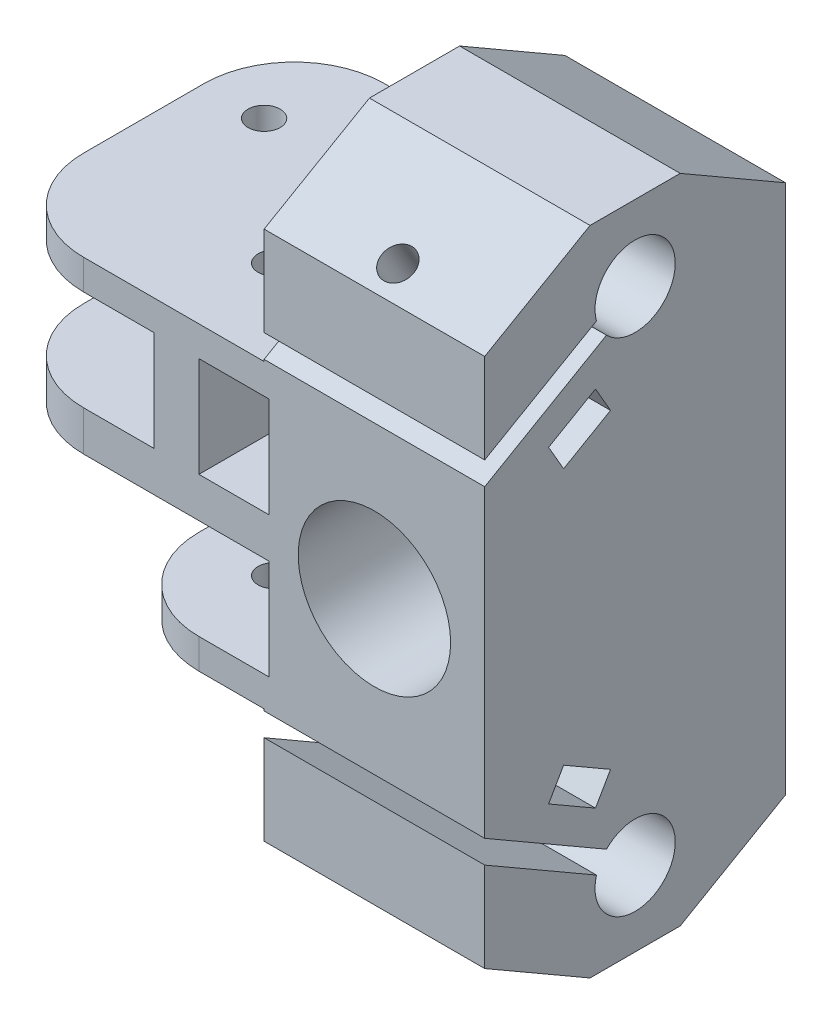
from build123d import *

# Parameters (mm, degrees)
ESBO_O2_R                  = 7.6
ESBO_O2_W                  = 7
ESBO_O2_H                  = 10
RESSALTO_EXTRUS_O1_DEPTH   = 30
CORTE_EXTRUS_O1_DEPTH      = 52.819397912
CORTE_EXTRUS_O2_DEPTH      = 68.825142831
CORTE_EXTRUS_O2_DEPTH_BACK = 68.825142831
ESBO_O4_R                  = 1.6
FILETE2_R                  = 9
CORTE_EXTRUS_O3_DEPTH      = 67.882564304
CORTE_EXTRUS_O3_DEPTH_BACK = 10
ESBO_O7_R                  = 1.6


with BuildPart() as part:
    # Esboço2 → Ressalto-extrusão1 (new body)
    with BuildSketch(Plane.XY):
        Polygon((-11, 15), (-11, 32.5), (11, 32.5), (11, -32.5), (-11, -32.5), (-11, -15), (-26.5, -15), (-26.5, -12), (-10.5, -12), (-10.5, -2), (-26.5, -2), (-38, -2), (-38, 2), (-22, 2), (-22, 12), (-38, 12), (-38, 15), align=None)
        Circle(ESBO_O2_R, mode=Mode.SUBTRACT)
        with Locations((-14, 7)):
            Rectangle(ESBO_O2_W, ESBO_O2_H, mode=Mode.SUBTRACT)
    extrude(amount=RESSALTO_EXTRUS_O1_DEPTH)

    # Esboço3 → Corte-extrusão1 (cut, through all)
    with BuildSketch(Plane.ZY.offset(11)):
        Polygon((30, 26.434795421), (19.494757511, 32.5), (30, 32.5), align=None)
        Polygon((18.952178178, 18.099406712), (23.628715358, 15.399406712), (22.128715358, 12.8013305), (17.452178178, 15.5013305), align=None)
        with BuildLine():
            Line((17.854101966, 22.197482923), (31.133039027, 14.530885036))
            Line((31.133039027, 14.530885036), (32.133039027, 16.262935844))
            Line((32.133039027, 16.262935844), (18.854101966, 23.929533731))
            ThreePointArc((18.854101966, 23.929533731), (11.535898385, 27), (17.854101966, 22.197482923))
        make_face()
        with BuildLine():
            Line((31.133039027, -14.530885036), (32.133039027, -16.262935844))
            Line((32.133039027, -16.262935844), (18.854101966, -23.929533731))
            ThreePointArc((18.854101966, -23.929533731), (11.535898385, -27), (17.854101966, -22.197482923))
            Line((17.854101966, -22.197482923), (31.133039027, -14.530885036))
        make_face()
        Polygon((23.628715358, -15.399406712), (22.128715358, -12.8013305), (17.452178178, -15.5013305), (18.952178178, -18.099406712), align=None)
        Polygon((0, 26.434795421), (10.505242489, 32.5), (0, 32.5), align=None)
        Polygon((30, -32.5), (19.494757511, -32.5), (30, -26.434795421), align=None)
        Polygon((0, -32.5), (10.505242489, -32.5), (0, -26.434795421), align=None)
    extrude(amount=-CORTE_EXTRUS_O1_DEPTH, mode=Mode.SUBTRACT)

    # Esboço4 → Corte-extrusão2 (cut, two sides: drawn at the far end of the back side and taken through both)
    with BuildSketch(Plane(origin=(0, 15, 0), x_dir=(1, 0, 0), z_dir=(0, 1, 0)).offset(-CORTE_EXTRUS_O2_DEPTH_BACK)):
        with Locations((-32, -9)):
            Circle(ESBO_O4_R)
        with Locations((-19, -21)):
            Circle(ESBO_O4_R)
    extrude(amount=CORTE_EXTRUS_O2_DEPTH + CORTE_EXTRUS_O2_DEPTH_BACK, mode=Mode.SUBTRACT)

    # Filete2
    filete2_edges = [part.edges().sort_by_distance(p)[0] for p in [
        (-38, 13.5, 30),
        (-38, 0, 30),
        (-38, 0, 0),
        (-38, 13.5, 0),
        (-26.5, -13.5, 30),
        (-26.5, -13.5, 0),
    ]]
    fillet(filete2_edges, radius=FILETE2_R)

    # Esboço7 → Corte-extrusão3 (cut, two sides: drawn at the far end of the back side and taken through both)
    with BuildSketch(Plane(origin=(0, 19.183012702, 11.075317547), x_dir=(1, 0, 0), z_dir=(0, 0.8660254037844418, 0.4999999999999945)).offset(-CORTE_EXTRUS_O3_DEPTH_BACK)):
        with Locations((0, -10.063364403)):
            Circle(ESBO_O7_R)
    extrude(amount=CORTE_EXTRUS_O3_DEPTH + CORTE_EXTRUS_O3_DEPTH_BACK, mode=Mode.SUBTRACT)


solid = part.part
